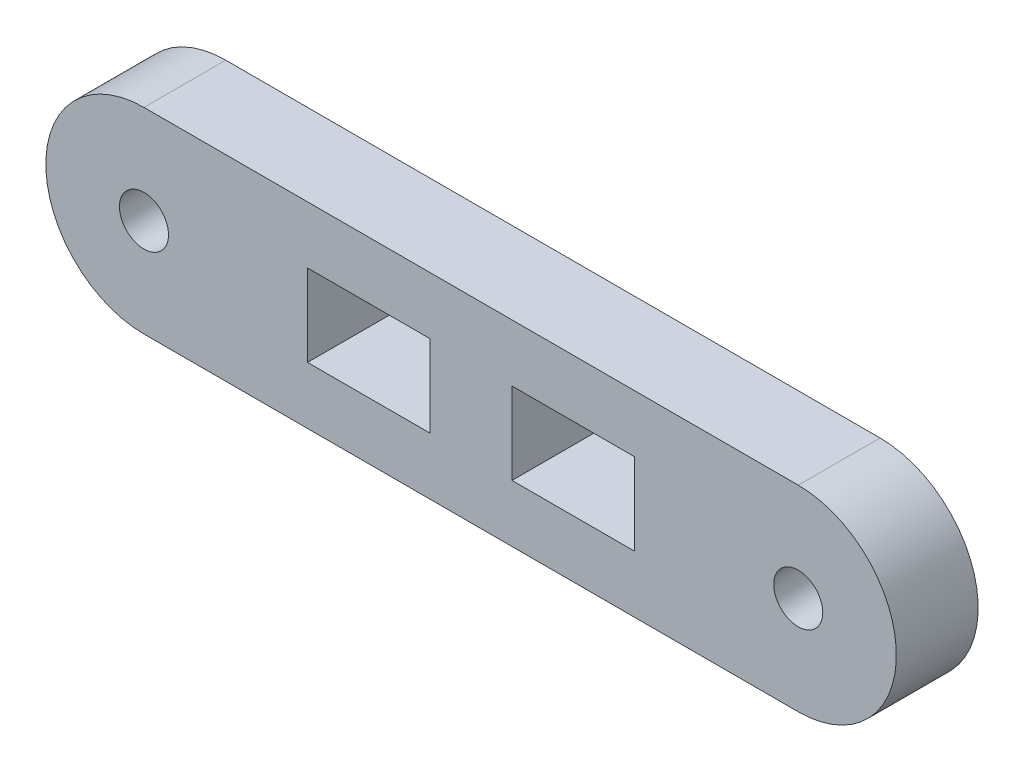
from build123d import *

# Parameters (mm, degrees)
ESQUISSE1_R        = 1.5
ESQUISSE1_W        = 7.5
ESQUISSE1_H        = 5
BOSS_EXTRU_1_DEPTH = 5


with BuildPart() as part:
    # Esquisse1 → Boss.-Extru.1 (new body)
    with BuildSketch(Plane.XY):
        with BuildLine():
            Line((0, 6), (40, 6))
            ThreePointArc((40, 6), (46, 0), (40, -6))
            Line((40, -6), (0, -6))
            ThreePointArc((0, -6), (-6, 0), (0, 6))
        make_face()
        with Locations((40, 0)):
            Circle(ESQUISSE1_R, mode=Mode.SUBTRACT)
        Circle(ESQUISSE1_R, mode=Mode.SUBTRACT)
        with Locations((26.25, 0)):
            Rectangle(ESQUISSE1_W, ESQUISSE1_H, mode=Mode.SUBTRACT)
        with Locations((13.75, 0)):
            Rectangle(ESQUISSE1_W, ESQUISSE1_H, mode=Mode.SUBTRACT)
    extrude(amount=BOSS_EXTRU_1_DEPTH)


solid = part.part
